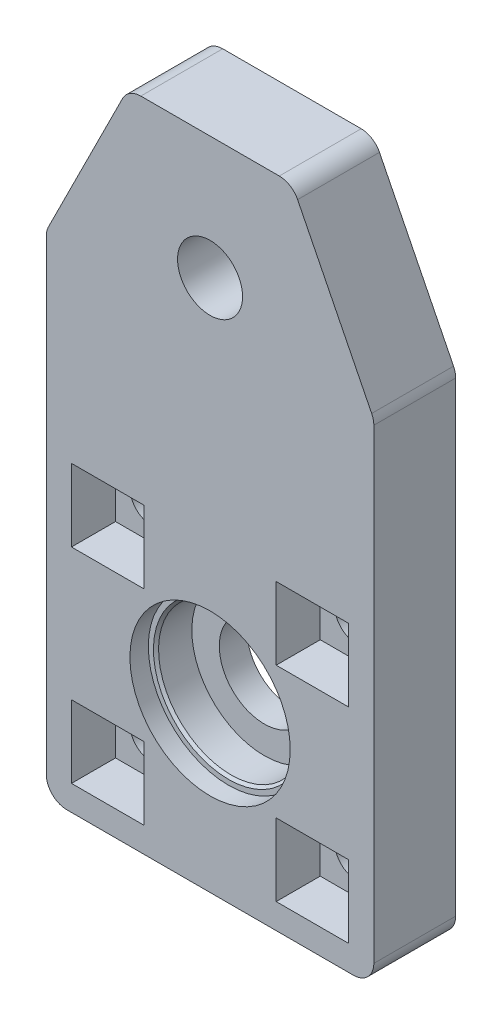
from build123d import *

# Parameters (mm, degrees)
BOSS_EXTRUDE1_DEPTH     = 6.35
F_3_8_CLEARANCE_HOLE1_D = 10.0838
BODY_MOVE_COPY2_ANGLE   = 90
F_1_4_CLEARANCE_HOLE1_D = 6.7564
SKETCH6_W               = 11.2395
SKETCH6_H               = 11.2395
CUT_EXTRUDE1_DEPTH      = 6.8326
F_3_8_CLEARANCE_HOLE3_D = 10.0838
FILLET1_R               = 3.175
F_3_8_CLEARANCE_HOLE2_D = 13.97


with BuildPart() as part:
    # Sketch2 → Boss-Extrude1 (new, symmetric)
    with BuildSketch(Plane.XY):
        Polygon((-25.4, -25.4), (25.4, -25.4), (25.4, 50.8), (12.7, 76.2), (-12.7, 76.2), (-25.4, 50.8), align=None)
    extrude(amount=BOSS_EXTRUDE1_DEPTH, both=True)

    # 3/8 Clearance Hole1 (through all)
    with Locations(Plane.XY.offset(6.35)):
        with Locations((0, 0), (0, 57.15)):
            Hole(F_3_8_CLEARANCE_HOLE1_D / 2)


with BuildPart() as body_2:
    # uxcell-FR6ZZ: read off the stored shape, not the designer's step
    # uxcell-FR6ZZ outline → uxcell-FR6ZZ (revolve)
    with BuildSketch(Plane(origin=(-48.38860798, 0, 0), x_dir=(1, 0, 0), z_dir=(0, 0, 1))):
        Polygon((12.430125, 12.468326067), (4.7625, 12.468326067), (4.7625, 4.054576067), (11.2395, 4.054576067), (11.2395, 9.213951067), (11.636375, 9.610826067), (12.430125, 9.610826067), align=None)
    revolve(axis=Axis((-48.38860798, 0, 0), (0, 1, 0)))


with BuildPart() as body_2_1:
    # Body-Move/Copy2: read off the stored shape, not the designer's step
    # Body-Move/Copy2: moved
    add(body_2.part.moved(Location((48.388608, -6.1183261, 0))).rotate(Axis((0, 0, 0), (1, 0, 0)), BODY_MOVE_COPY2_ANGLE))


with BuildPart() as part_1:
    add(part.part)

    # Combine1: cut body 2
    add(body_2_1.part, mode=Mode.SUBTRACT)

    # 1/4 Clearance Hole1 (through all)
    with Locations(Plane.XY.offset(6.35)):
        with Locations((-15.875, 15.875), (15.875, 15.875), (15.875, -15.875), (-15.875, -15.875)):
            Hole(F_1_4_CLEARANCE_HOLE1_D / 2)

    # Sketch6 → Cut-Extrude1 (cut)
    with BuildSketch(Plane.XY.offset(6.35)):
        with Locations((-15.875, 15.875)):
            Rectangle(SKETCH6_W, SKETCH6_H)
    cut_extrude1 = extrude(amount=-CUT_EXTRUDE1_DEPTH, mode=Mode.SUBTRACT)

    # Sketch-Pattern1: Cut-Extrude1 at 3 more places
    with Locations((0, -31.75, 0), (31.75, -31.75, 0), (31.75, 0, 0)):
        add(cut_extrude1, mode=Mode.SUBTRACT)

    # 3/8 Clearance Hole3 (through all)
    with Locations(Plane(origin=(0, 0, -6.35), x_dir=(-1, 0, 0), z_dir=(0, 0, -1))):
        with Locations((0, 57.15)):
            Hole(F_3_8_CLEARANCE_HOLE3_D / 2)

    # Fillet1
    fillet1_edges = [part_1.edges().sort_by_distance(p)[0] for p in [
        (-25.4, 50.8, 0),
        (-12.7, 76.2, 0),
        (12.7, 76.2, 0),
        (25.4, 50.8, 0),
        (25.4, -25.4, 0),
        (-25.4, -25.4, 0),
    ]]
    fillet(fillet1_edges, radius=FILLET1_R)

    # 3/8 Clearance Hole2 (through all)
    with Locations(Plane.XY.offset(6.35)):
        with Locations((0, 0)):
            Hole(F_3_8_CLEARANCE_HOLE2_D / 2)


solid = part_1.part
